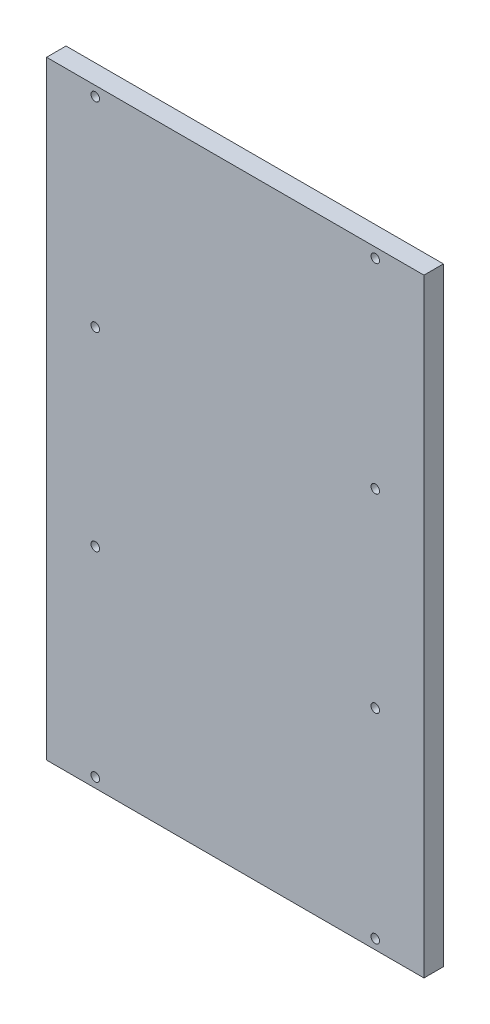
from build123d import *

# Parameters (mm, degrees)
SKETCH_1_W          = 310
SKETCH_1_H          = 500
EXTRUDE_5910_DEPTH  = 16
SKETCH_3_R          = 3.5
CUT_EXTRUDE_1_DEPTH = 16
SKETCH_4_R          = 3.5
CUT_EXTRUDE_2_DEPTH = 16
SKETCH_5_R          = 3.5
CUT_EXTRUDE_3_DEPTH = 16
SKETCH_6_R          = 3.5
CUT_EXTRUDE_4_DEPTH = 16
SKETCH_7_R          = 3.5
CUT_EXTRUDE_5_DEPTH = 16
SKETCH_8_R          = 3.5
CUT_EXTRUDE_6_DEPTH = 16
SKETCH_9_R          = 3.5
CUT_EXTRUDE_7_DEPTH = 16
SKETCH_10_R         = 3.5
CUT_EXTRUDE_8_DEPTH = 16


with BuildPart() as part:
    # Эскиз1 → Extrude 5910 (new body)
    with BuildSketch(Plane.XY):
        with Locations((155, 250)):
            Rectangle(SKETCH_1_W, SKETCH_1_H)
    extrude(amount=EXTRUDE_5910_DEPTH)

    # Эскиз3 → Cut-Extrude 1 (cut)
    with BuildSketch(Plane.XY.offset(16)):
        with Locations((40, 8)):
            Circle(SKETCH_3_R)
    extrude(amount=-CUT_EXTRUDE_1_DEPTH, mode=Mode.SUBTRACT)

    # Эскиз4 → Cut-Extrude 2 (cut)
    with BuildSketch(Plane.XY.offset(16)):
        with Locations((270, 8)):
            Circle(SKETCH_4_R)
    extrude(amount=-CUT_EXTRUDE_2_DEPTH, mode=Mode.SUBTRACT)

    # Эскиз5 → Cut-Extrude 3 (cut)
    with BuildSketch(Plane.XY.offset(16)):
        with Locations((40, 492)):
            Circle(SKETCH_5_R)
    extrude(amount=-CUT_EXTRUDE_3_DEPTH, mode=Mode.SUBTRACT)

    # Эскиз6 → Cut-Extrude 4 (cut)
    with BuildSketch(Plane.XY.offset(16)):
        with Locations((270, 492)):
            Circle(SKETCH_6_R)
    extrude(amount=-CUT_EXTRUDE_4_DEPTH, mode=Mode.SUBTRACT)

    # Эскиз7 → Отверстие 5 (cut)
    with BuildSketch(Plane.XY.offset(16)):
        with Locations((40, 172)):
            Circle(SKETCH_7_R)
    extrude(amount=-CUT_EXTRUDE_5_DEPTH, mode=Mode.SUBTRACT)

    # Эскиз8 → Отверстие 6 (cut)
    with BuildSketch(Plane.XY.offset(16)):
        with Locations((270, 172)):
            Circle(SKETCH_8_R)
    extrude(amount=-CUT_EXTRUDE_6_DEPTH, mode=Mode.SUBTRACT)

    # Эскиз9 → Отверстие 7 (cut)
    with BuildSketch(Plane.XY.offset(16)):
        with Locations((40, 328)):
            Circle(SKETCH_9_R)
    extrude(amount=-CUT_EXTRUDE_7_DEPTH, mode=Mode.SUBTRACT)

    # Эскиз10 → Отверстие 8 (cut)
    with BuildSketch(Plane.XY.offset(16)):
        with Locations((270, 328)):
            Circle(SKETCH_10_R)
    extrude(amount=-CUT_EXTRUDE_8_DEPTH, mode=Mode.SUBTRACT)


solid = part.part
